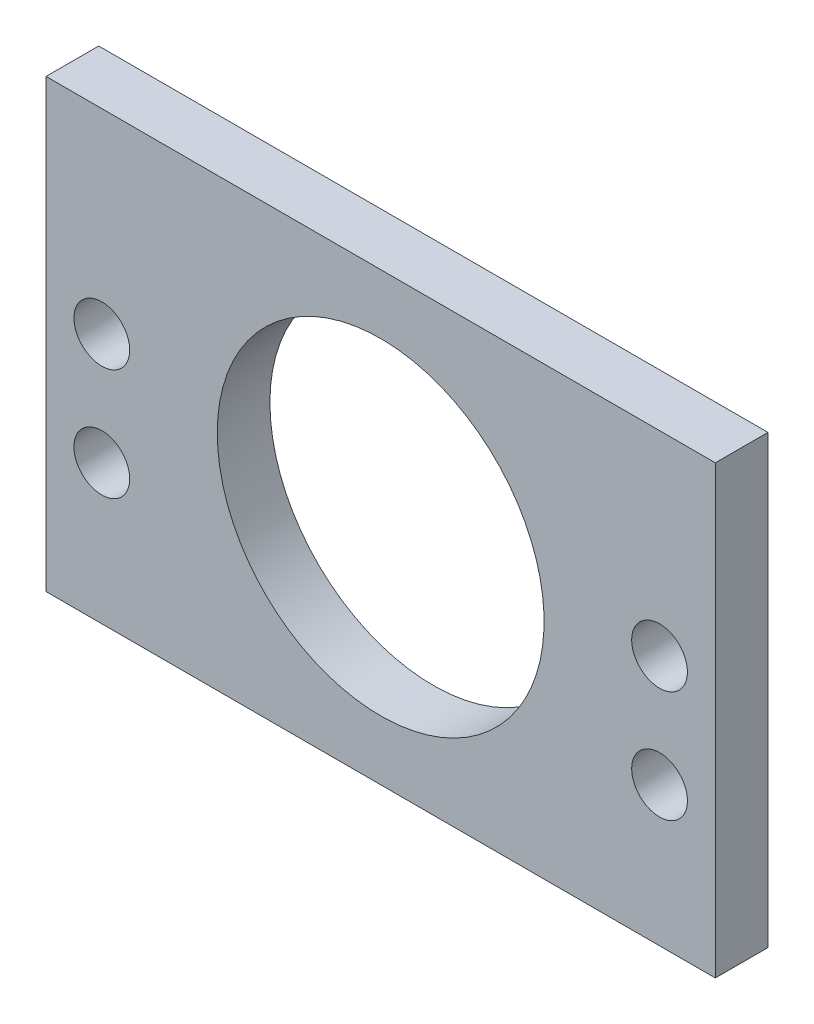
from build123d import *

# Parameters (mm, degrees)
SKETCH1_W           = 76.2
SKETCH1_H           = 50.8
SKETCH1_R           = 18.6055
SKETCH1_R_2         = 3.175
BOSS_EXTRUDE1_DEPTH = 5.9944


with BuildPart() as part:
    # Sketch1 → Boss-Extrude1 (new body)
    with BuildSketch(Plane.XY):
        with Locations((38.1, 25.4)):
            Rectangle(SKETCH1_W, SKETCH1_H)
        with Locations((38.1, 25.4)):
            Circle(SKETCH1_R, mode=Mode.SUBTRACT)
        with Locations((6.35, 28.575)):
            Circle(SKETCH1_R_2, mode=Mode.SUBTRACT)
        with Locations((6.35, 15.875)):
            Circle(SKETCH1_R_2, mode=Mode.SUBTRACT)
        with Locations((69.85, 28.575)):
            Circle(SKETCH1_R_2, mode=Mode.SUBTRACT)
        with Locations((69.85, 15.875)):
            Circle(SKETCH1_R_2, mode=Mode.SUBTRACT)
    extrude(amount=BOSS_EXTRUDE1_DEPTH)


solid = part.part
